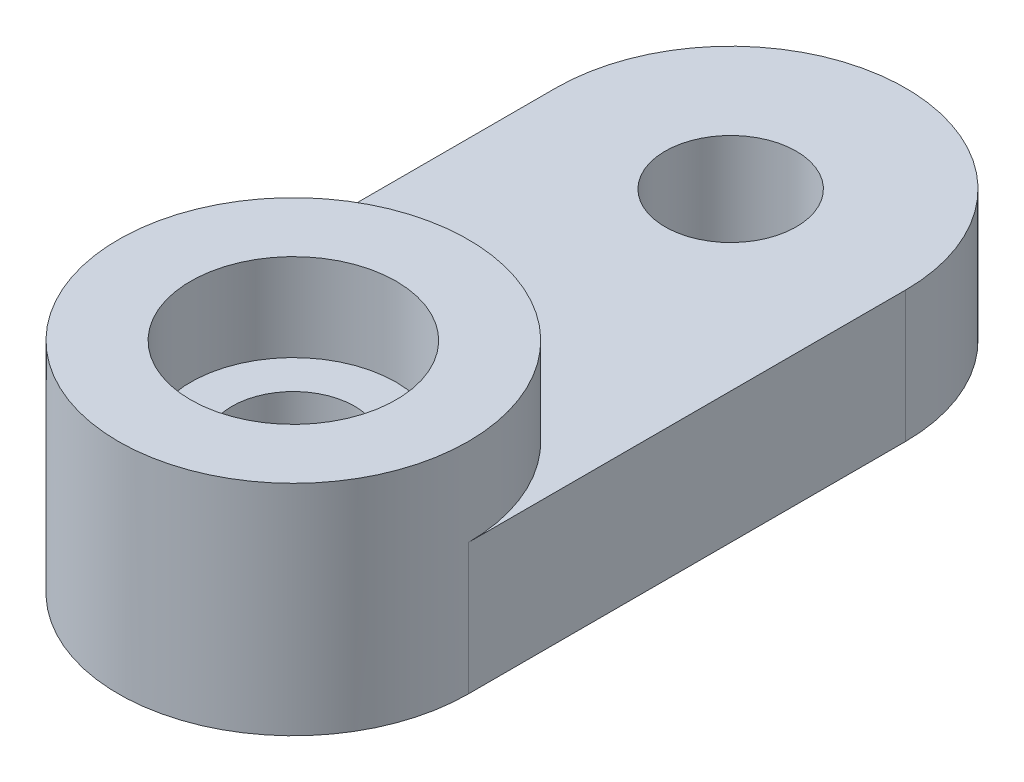
from build123d import *

# Parameters (mm, degrees)
SKETCH1_R           = 1.778
SKETCH1_R_2         = 1.905
BASE_DEPTH          = 3.81
SKETCH2_R           = 5.08
SKETCH2_R_2         = 2.9845
BOSS_EXTRUDE2_DEPTH = 2.54


with BuildPart() as part:
    # Sketch1 → base (new body)
    with BuildSketch(Plane(origin=(0, 0, 0), x_dir=(1, 0, 0), z_dir=(0, 1, 0))):
        with BuildLine():
            Line((-5.08, 0), (-5.08, 12.7))
            ThreePointArc((-5.08, 12.7), (0, 17.78), (5.08, 12.7))
            Line((5.08, 12.7), (5.08, 0))
            ThreePointArc((5.08, 0), (0, -5.08), (-5.08, 0))
        make_face()
        Circle(SKETCH1_R, mode=Mode.SUBTRACT)
        with Locations((0, 12.7)):
            Circle(SKETCH1_R_2, mode=Mode.SUBTRACT)
    extrude(amount=BASE_DEPTH)

    # Sketch2 → Boss-Extrude2 (add)
    with BuildSketch(Plane(origin=(0, 3.81, 0), x_dir=(1, 0, 0), z_dir=(0, 1, 0))):
        Circle(SKETCH2_R)
        Circle(SKETCH2_R_2, mode=Mode.SUBTRACT)
    extrude(amount=BOSS_EXTRUDE2_DEPTH)


solid = part.part
